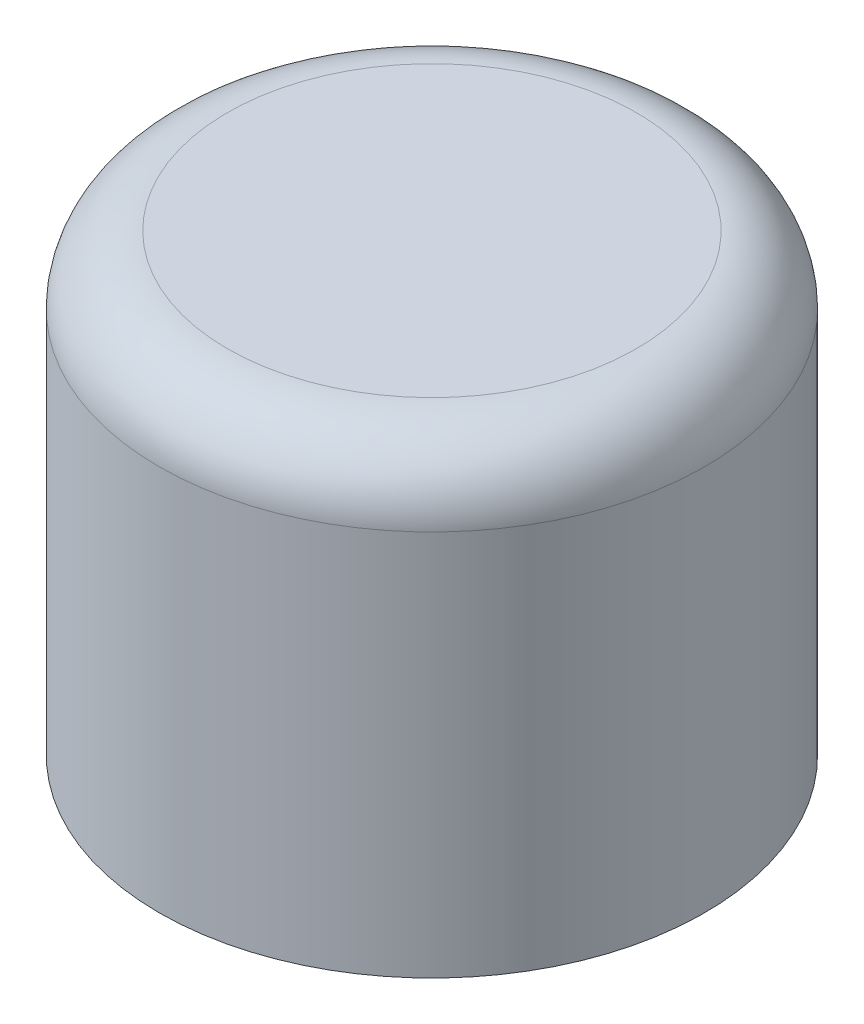
from build123d import *

# Parameters (mm, degrees)
SKETCH1_R           = 6
SKETCH1_R_2         = 5.25
SKETCH1_W           = 0.8
SKETCH1_H           = 11.973303638
BOSS_EXTRUDE1_DEPTH = 8
SKETCH4_R           = 6
BOSS_EXTRUDE2_DEPTH = 2
FILLET1_R           = 1.5


with BuildPart() as part:
    # Sketch1 → Boss-Extrude1 (new body)
    # profile 1 of 2: a face of its own
    with BuildSketch(Plane(origin=(0, 0, 0), x_dir=(1, 0, 0), z_dir=(0, 1, 0))):
        Circle(SKETCH1_R)
        Circle(SKETCH1_R_2, mode=Mode.SUBTRACT)
    # profile 2 of 2: a face of its own
    with BuildSketch(Plane(origin=(0, 0, 0), x_dir=(1, 0, 0), z_dir=(0, 1, 0))):
        Rectangle(SKETCH1_W, SKETCH1_H)
    extrude(amount=BOSS_EXTRUDE1_DEPTH)

    # Sketch4 → Boss-Extrude2 (add)
    with BuildSketch(Plane(origin=(0, 8, 0), x_dir=(1, 0, 0), z_dir=(0, 1, 0))):
        Circle(SKETCH4_R)
    extrude(amount=BOSS_EXTRUDE2_DEPTH)

    # Fillet1
    fillet1_edges = [part.edges().sort_by_distance(p)[0] for p in [
        (-6, 10, 0),
    ]]
    fillet(fillet1_edges, radius=FILLET1_R)


solid = part.part
